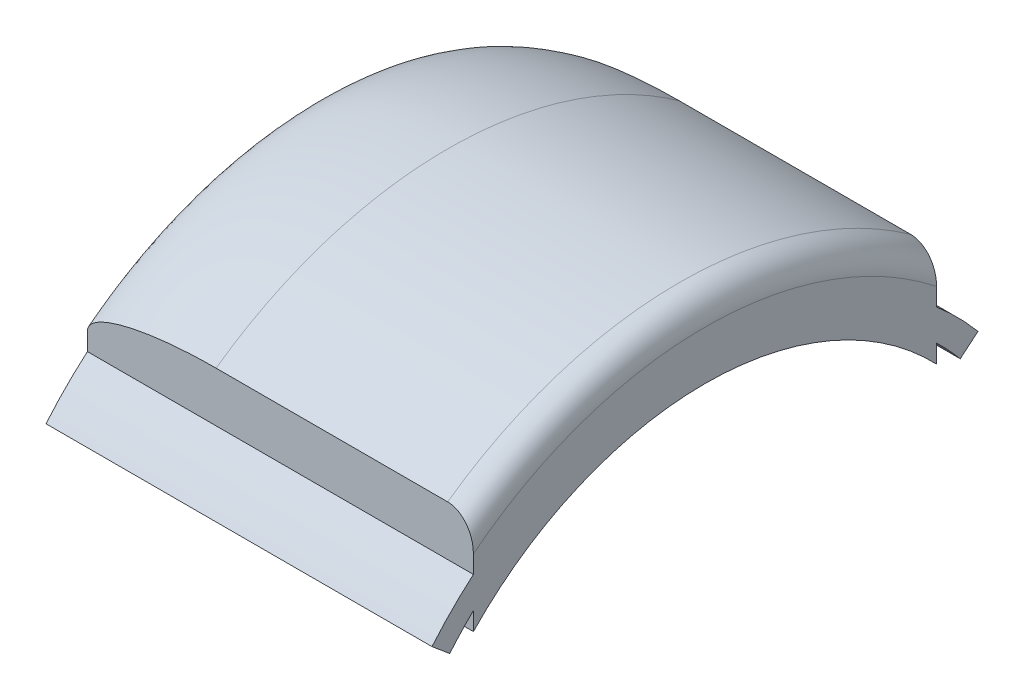
from build123d import *

# Parameters (mm, degrees)
P_IDAT_VYSUNUT_M2_DEPTH  = 15
SKICA3_W                 = 28.958839484
SKICA3_H                 = 34.368053108
ODEBRAT_VYSUNUT_M2_DEPTH = 19.470465231
ZAOBLIT7_R               = 1
ZAOBLIT8_SIZE            = 5
ZAOBLIT8_SIZE_2          = 1


# Read off the part's stored shape, not the designer's step: Přidat vysunutím2
with BuildPart() as part:
    # Skica1 → Rotovat1 (revolve)
    with BuildSketch(Plane.XY, mode=Mode.PRIVATE) as rotovat1_sk:
        with BuildLine():
            Line((-18.006318941, 12.994441011), (-18.006318941, 0))
            Line((-18.006318941, 0), (-15.006318941, 0))
            Line((-15.006318941, 0), (-15.006318941, 10.5))
            Line((-15.006318941, 10.5), (-5.006318941, 10.5))
            Line((-5.006318941, 10.5), (-5.006318941, 12.5))
            Line((-5.006318941, 12.5), (7.993681059, 12.5))
            Line((7.993681059, 12.5), (9.993681059, 12.604815559))
            Line((9.993681059, 12.604815559), (9.993681059, 14.5))
            ThreePointArc((9.993681059, 14.5), (9.70078784, 15.207106781), (8.993681059, 15.5))
            Line((8.993681059, 15.5), (-4.506318941, 15.5))
            Line((-4.506318941, 15.5), (-18.006318941, 12.994441011))
        make_face()
    revolve(rotovat1_sk.sketch.rotate(Axis((-22.002499385, 0, 0), (1, 0, 0)), 90), axis=Axis((-22.002499385, 0, 0), (1, 0, 0)))

    # Přidat vysunutím2 outline → Přidat vysunutím2 (add)
    with BuildSketch(Plane(origin=(9.993681059, 0, 0), x_dir=(0, 0, -1), z_dir=(1, 0, 0))):
        with BuildLine():
            ThreePointArc((9, 12.619429464), (0, 15.5), (-9, 12.619429464))
            Line((-9, 12.619429464), (-9, 10.677226605))
            ThreePointArc((-9, 10.677226605), (-9.838449164, 9.89820076), (-10.609715537, 9.052608394))
            Line((-10.609715537, 9.052608394), (-9.920275538, 8.474099545))
            ThreePointArc((-9.920275538, 8.474099545), (-9.473009337, 8.979756174), (-9, 9.461417722))
            Line((-9, 9.461417722), (-9, 8.752470575))
            ThreePointArc((-9, 8.752470575), (0, 12.6), (9, 8.752470575))
            Line((9, 8.752470575), (9, 9.461417722))
            ThreePointArc((9, 9.461417722), (9.473009337, 8.979756174), (9.920275538, 8.474099545))
            Line((9.920275538, 8.474099545), (10.609715537, 9.052608394))
            ThreePointArc((10.609715537, 9.052608394), (9.838449164, 9.89820076), (9, 10.677226605))
            Line((9, 10.677226605), (9, 12.619429464))
        make_face()
    extrude(amount=P_IDAT_VYSUNUT_M2_DEPTH)

    # Skica3 → Odebrat vysunutím2 (cut, symmetric)
    with BuildSketch(Plane.XY):
        with Locations((-4.485738683, -0.096675255)):
            Rectangle(SKICA3_W, SKICA3_H)
    extrude(amount=ODEBRAT_VYSUNUT_M2_DEPTH, both=True, mode=Mode.SUBTRACT)

    # Zaoblit7
    zaoblit7_edges = [part.edges().sort_by_distance(p)[0] for p in [
        (24.993681059, 15.5, 0),
    ]]
    fillet(zaoblit7_edges, radius=ZAOBLIT7_R)

    # Zaoblit8
    # an asymmetric fillet: 5, 1 mm, written as the material it takes off along each edge
    with BuildSketch(Plane(origin=(9.993681059, 1e-09, 0), x_dir=(0, 0.1441186549809942, -0.9895604141670529), z_dir=(0, -0.9895604141670529, -0.1441186549809942))) as zaoblit8_piece_1:
        with BuildLine():
            Bezier((15.499999999, ZAOBLIT8_SIZE), (15.499999999, 0), (15.499999999 - ZAOBLIT8_SIZE_2, 0), weights=[1, 0.707106781, 1])
            Line((15.499999999 - ZAOBLIT8_SIZE_2, 0), (15.499999999, 0))
            Line((15.499999999, 0), (15.499999999, ZAOBLIT8_SIZE))
        make_face()
    revolve(axis=Axis((9.993681059, 1e-09, 0), (1, 0, 0)), revolution_arc=163.427508421, mode=Mode.SUBTRACT)


solid = part.part
